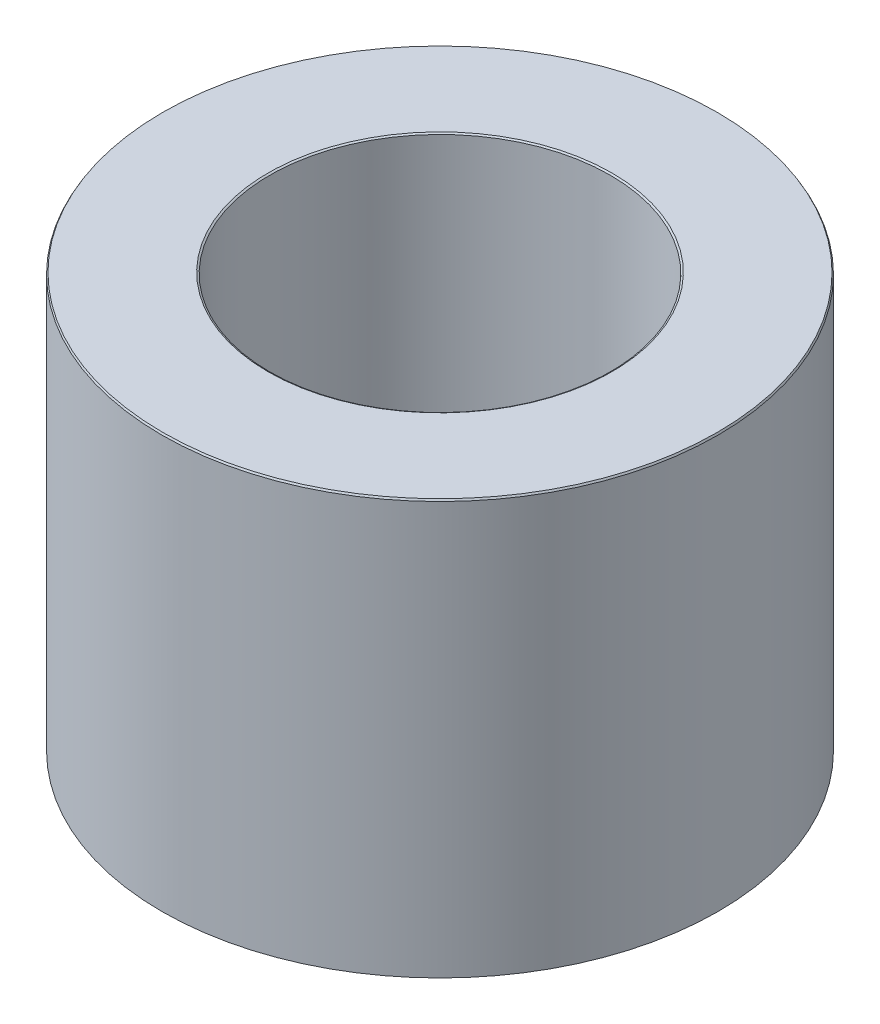
from build123d import *
from OCP.BRepFilletAPI import BRepFilletAPI_MakeChamfer

# Parameters (mm, degrees)
SKETCH1_R           = 32.5
BOSS_EXTRUDE1_DEPTH = 48.517535223
SKETCH2_R           = 19.89491929
CUT_EXTRUDE1_DEPTH  = 67.831513705
CHAMFER1_SIZE       = 0.203204196
CHAMFER1_SIZE2      = 0.117319997


with BuildPart() as part:
    # Sketch1 → Boss-Extrude1 (new body)
    with BuildSketch(Plane(origin=(0, 0, 0), x_dir=(1, 0, 0), z_dir=(0, 1, 0))):
        Circle(SKETCH1_R)
    extrude(amount=BOSS_EXTRUDE1_DEPTH)

    # Sketch2 → Cut-Extrude1 (cut, through all)
    with BuildSketch(Plane(origin=(0, 0, 0), x_dir=(1, 0, 0), z_dir=(0, 1, 0))):
        Circle(SKETCH2_R)
    extrude(amount=CUT_EXTRUDE1_DEPTH, mode=Mode.SUBTRACT)

    # Chamfer1: one chamfer whose edges measure the first distance from different faces: ONE call of the kernel's chamfer builder (chamfer() names one face for all edges)
    chamfer1_edges_1 = [part.edges().sort_by_distance(p)[0] for p in [
        (-19.89491929, 48.517535223, 0),
    ]]
    chamfer1_side_1 = [part.faces().sort_by_distance(p)[0] for p in [
        (-31.580761184, 48.517535223, 0),
    ]]
    chamfer1_edges_2 = [part.edges().sort_by_distance(p)[0] for p in [
        (-19.89491929, 0, 0),
    ]]
    chamfer1_side_2 = [part.faces().sort_by_distance(p)[0] for p in [
        (-19.89491929, 24.258767612, 0),
    ]]
    chamfer1_edges_3 = [part.edges().sort_by_distance(p)[0] for p in [
        (-32.5, 0, 0),
    ]]
    chamfer1_side_3 = [part.faces().sort_by_distance(p)[0] for p in [
        (-31.580761184, 0, 0),
    ]]
    chamfer1_edges_4 = [part.edges().sort_by_distance(p)[0] for p in [
        (-32.5, 48.517535223, 0),
    ]]
    chamfer1_side_4 = [part.faces().sort_by_distance(p)[0] for p in [
        (-32.5, 24.258767612, 0),
    ]]
    chamfer1 = BRepFilletAPI_MakeChamfer(part.part.solid().wrapped)
    for e in chamfer1_edges_1:
        chamfer1.Add(CHAMFER1_SIZE, CHAMFER1_SIZE2, e.wrapped, chamfer1_side_1[0].wrapped)  # the first distance lies on this face
    for e in chamfer1_edges_2:
        chamfer1.Add(CHAMFER1_SIZE, CHAMFER1_SIZE2, e.wrapped, chamfer1_side_2[0].wrapped)  # the first distance lies on this face
    for e in chamfer1_edges_3:
        chamfer1.Add(CHAMFER1_SIZE, CHAMFER1_SIZE2, e.wrapped, chamfer1_side_3[0].wrapped)  # the first distance lies on this face
    for e in chamfer1_edges_4:
        chamfer1.Add(CHAMFER1_SIZE, CHAMFER1_SIZE2, e.wrapped, chamfer1_side_4[0].wrapped)  # the first distance lies on this face
    add(Compound.cast(chamfer1.Shape()), mode=Mode.REPLACE)


solid = part.part
